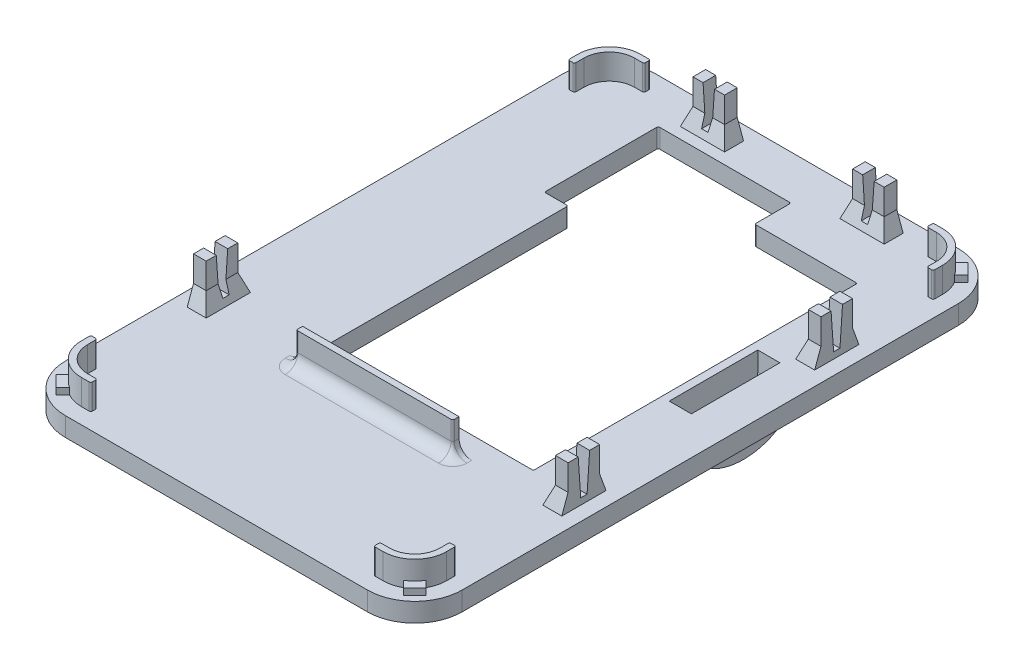
from build123d import *

# Parameters (mm, degrees)
BOSSAGE_BASE_DEPTH                 = 1.5
BOSSAGE_CORNER_DEPTH               = 4
CONGE_CORNER_R                     = 0.25
CONGE_CORNER_OF_SYM_TRIE1_CORNER_R = 0.25
SYM_TRIE2_CORNER_START             = 1
SYM_TRIE2_CORNER_DEPTH             = 4.5
ENL_V_OPENING_DEPTH                = 57.735818713
ENL_V_OPENING_DEPTH_BACK           = 57.735818713
ESQUISSE4_W                        = 3.5
ESQUISSE4_H                        = 14
BALAYAGE_BATTERIE_START            = 21.875
BALAYAGE_BATTERIE_DEPTH            = 3.5
BOSSAGE_BATTERIE_DEPTH             = 1.25
ESQUISSE8_W                        = 5
ESQUISSE8_H                        = 2
ESQUISSE8_W_2                      = 2
ESQUISSE8_H_2                      = 5
BOSSAGE_CLIP_DEPTH                 = 6.8
ENL_V_CLIP_RIGHT_REACH             = 78.907
ENL_V_CLIP_BACK_RIGHT_REACH        = 98.85
ENL_V_CLIP_BACK_LEFT_REACH         = 98.85
ENL_V_CLIP_LEFT1_REACH             = 99.397
ENL_V_CLIP_LEFT2_REACH             = 99.397
CHANFREIN_CLIP_SIZE                = 1
CHANFREIN_CLIP_SIZE_2              = 2.747477419
ESQUISSE15_W                       = 24.75
ESQUISSE15_H                       = 1
BOSSAGE_PALETTE_DEPTH              = 5
CONG_OPENING_R                     = 0.25
CONG_PALETTE_R                     = 2
BOSSAGE_SPACING_DEPTH              = 2.5


with BuildPart() as part:
    # Esquisse1 → Bossage_base (new, symmetric)
    with BuildSketch(Plane(origin=(0, 0, 0), x_dir=(1, 0, 0), z_dir=(0, 1, 0))):
        with BuildLine():
            Line((-23.875, -46.75), (23.875, -46.75))
            ThreePointArc((23.875, -46.75), (29.178300859, -44.553300859), (31.375, -39.25))
            Line((31.375, -39.25), (31.375, 39.25))
            ThreePointArc((31.375, 39.25), (29.178300859, 44.553300859), (23.875, 46.75))
            Line((23.875, 46.75), (-23.875, 46.75))
            ThreePointArc((-23.875, 46.75), (-29.178300859, 44.553300859), (-31.375, 39.25))
            Line((-31.375, 39.25), (-31.375, -39.25))
            ThreePointArc((-31.375, -39.25), (-29.178300859, -44.553300859), (-23.875, -46.75))
        make_face()
    extrude(amount=BOSSAGE_BASE_DEPTH, both=True)

    # Esquisse3 → Bossage_corner (add)
    with BuildSketch(Plane(origin=(0, 1.5, 0), x_dir=(1, 0, 0), z_dir=(0, 1, 0))):
        with BuildLine():
            Line((-23.875, 44.25), (-22.375, 44.25))
            Line((-22.375, 44.25), (-22.375, 43.25))
            Line((-22.375, 43.25), (-23.875, 43.25))
            ThreePointArc((-23.875, 43.25), (-26.703427125, 42.078427125), (-27.875, 39.25))
            Line((-27.875, 39.25), (-27.875, 37.75))
            Line((-27.875, 37.75), (-28.875, 37.75))
            Line((-28.875, 37.75), (-28.875, 39.25))
            ThreePointArc((-28.875, 39.25), (-27.410533906, 42.785533906), (-23.875, 44.25))
        make_face()
    bossage_corner = extrude(amount=BOSSAGE_CORNER_DEPTH)

    # Conge_corner
    conge_corner_edges = [part.edges().sort_by_distance(p)[0] for p in [
        (-22.375, 3.5, -43.25),
        (-22.375, 3.5, -44.25),
        (-28.875, 3.5, -37.75),
        (-27.875, 3.5, -37.75),
    ]]
    fillet(conge_corner_edges, radius=CONGE_CORNER_R)

    # Symétrie1_corner: Bossage_corner across plane
    add(bossage_corner.mirror(Plane(origin=(0, 0, 0), x_dir=(0, 0, 1), z_dir=(1, 0, 0))))

    # Conge_corner of Symétrie1_corner
    conge_corner_of_sym_trie1_corner_edges = [part.edges().sort_by_distance(p)[0] for p in [
        (22.375, 3.5, -43.25),
        (22.375, 3.5, -44.25),
        (28.875, 3.5, -37.75),
        (27.875, 3.5, -37.75),
    ]]
    fillet(conge_corner_of_sym_trie1_corner_edges, radius=CONGE_CORNER_OF_SYM_TRIE1_CORNER_R)

    # Symétrie2_corner: read off the stored shape, not the designer's step
    # Symétrie2_corner outline → Symétrie2_corner (add)
    with BuildSketch(Plane(origin=(0, 0, 0), x_dir=(1, 0, 0), z_dir=(0, 1, 0)).offset(SYM_TRIE2_CORNER_START)):
        with BuildLine():
            ThreePointArc((-22.625, -44.25), (-22.448223305, -44.176776695), (-22.375, -44))
            Line((-22.375, -44), (-22.375, -43.5))
            ThreePointArc((-22.375, -43.5), (-22.448223305, -43.323223305), (-22.625, -43.25))
            Line((-22.625, -43.25), (-23.875, -43.25))
            ThreePointArc((-23.875, -43.25), (-26.703427125, -42.078427125), (-27.875, -39.25))
            Line((-27.875, -39.25), (-27.875, -38))
            ThreePointArc((-27.875, -38), (-27.948223305, -37.823223305), (-28.125, -37.75))
            Line((-28.125, -37.75), (-28.625, -37.75))
            ThreePointArc((-28.625, -37.75), (-28.801776695, -37.823223305), (-28.875, -38))
            Line((-28.875, -38), (-28.875, -39.25))
            ThreePointArc((-28.875, -39.25), (-27.410533906, -42.785533906), (-23.875, -44.25))
            Line((-23.875, -44.25), (-22.625, -44.25))
        make_face()
        with BuildLine():
            Line((27.875, -38), (27.875, -39.25))
            ThreePointArc((27.875, -39.25), (26.703427125, -42.078427125), (23.875, -43.25))
            Line((23.875, -43.25), (22.625, -43.25))
            ThreePointArc((22.625, -43.25), (22.448223305, -43.323223305), (22.375, -43.5))
            Line((22.375, -43.5), (22.375, -44))
            ThreePointArc((22.375, -44), (22.448223305, -44.176776695), (22.625, -44.25))
            Line((22.625, -44.25), (23.875, -44.25))
            ThreePointArc((23.875, -44.25), (27.410533906, -42.785533906), (28.875, -39.25))
            Line((28.875, -39.25), (28.875, -38))
            ThreePointArc((28.875, -38), (28.801776695, -37.823223305), (28.625, -37.75))
            Line((28.625, -37.75), (28.125, -37.75))
            ThreePointArc((28.125, -37.75), (27.948223305, -37.823223305), (27.875, -38))
        make_face()
    extrude(amount=SYM_TRIE2_CORNER_DEPTH)

    # Esquisse4 → Enlèv_opening (cut, two sides: drawn at the far end of the back side and taken through both)
    with BuildSketch(Plane(origin=(0, -1.5, 0), x_dir=(-1, 0, 0), z_dir=(0, -1, 0)).offset(-ENL_V_OPENING_DEPTH_BACK)):
        Polygon((-20.625, 34), (-4.375, 34), (-4.375, 39.75), (16.625, 39.75), (16.625, 21.75), (12.875, 21.75), (12.875, -20.5), (-3.625, -20.5), (-3.625, -17.25), (-20.625, -17.25), align=None)
        with Locations((-23.625, 10)):
            Rectangle(ESQUISSE4_W, ESQUISSE4_H)
    extrude(amount=ENL_V_OPENING_DEPTH + ENL_V_OPENING_DEPTH_BACK, mode=Mode.SUBTRACT)

    # Balayage_batterie: read off the stored shape, not the designer's step
    # Balayage_batterie outline → Balayage_batterie (add)
    with BuildSketch(Plane.YZ.offset(BALAYAGE_BATTERIE_START)):
        with BuildLine():
            Line((-1.5, -3), (-1.5, -1.75))
            add(Edge.make_bspline(
                [(-1.5, -1.75), (-3.190722232, -1.750000002), (-4.786990528, -2.705218815), (-7.00497116, -5.780146506), (-7.625, -7.885757532), (-7.625, -12.114242468), (-7.00497116, -14.219853494), (-4.786990528, -17.294781185), (-3.190722232, -18.249999998), (-1.5, -18.25)],
                knots=[0, 0, 0, 0, 0.25, 0.25, 0.5, 0.5, 0.75, 0.75, 1, 1, 1, 1], degree=3))
            Line((-1.5, -18.25), (-1.5, -17))
            add(Edge.make_bspline(
                [(-1.5, -3), (-2.708159254, -3.000000002), (-3.954865391, -3.68832461), (-5.809522107, -6.259553243), (-6.375, -8.121805918), (-6.375, -11.878194082), (-5.809522107, -13.740446757), (-3.954865391, -16.31167539), (-2.708159254, -16.999999998), (-1.5, -17)],
                knots=[0, 0, 0, 0, 0.25, 0.25, 0.5, 0.5, 0.75, 0.75, 1, 1, 1, 1], degree=3))
        make_face()
    extrude(amount=BALAYAGE_BATTERIE_DEPTH)

    # Esquisse7 → Bossage_batterie (add)
    with BuildSketch(Plane(origin=(25.375, 0, 0), x_dir=(0, 0, -1), z_dir=(1, 0, 0))):
        with BuildLine():
            Line((1.75, -1.5), (18.25, -1.5))
            add(Edge.make_bspline(
                [(1.75, -1.5), (1.750000002, -3.190722232), (2.705218815, -4.786990528), (5.780146506, -7.00497116), (7.885757532, -7.625), (12.114242468, -7.625), (14.219853494, -7.00497116), (17.294781185, -4.786990528), (18.249999998, -3.190722232), (18.25, -1.5)],
                knots=[0, 0, 0, 0, 0.25, 0.25, 0.5, 0.5, 0.75, 0.75, 1, 1, 1, 1], degree=3))
        make_face()
    bossage_batterie = extrude(amount=BOSSAGE_BATTERIE_DEPTH)

    # Symétrie_batterie: Bossage_batterie across plane
    add(bossage_batterie.mirror(Plane.ZY.offset(-23.625)))

    # Esquisse8 → Bossage_clip (add)
    with BuildSketch(Plane(origin=(0, 1.5, 0), x_dir=(1, 0, 0), z_dir=(0, 1, 0))):
        with Locations((13.875, 43.5)):
            Rectangle(ESQUISSE8_W, ESQUISSE8_H)
        with Locations((-11.375, 43.5)):
            Rectangle(ESQUISSE8_W, ESQUISSE8_H)
        with Locations((-28.125, -18.75)):
            Rectangle(ESQUISSE8_W_2, ESQUISSE8_H_2)
        with Locations((28.125, 22.25)):
            Rectangle(ESQUISSE8_W_2, ESQUISSE8_H_2)
        with Locations((28.125, -17.75)):
            Rectangle(ESQUISSE8_W_2, ESQUISSE8_H_2)
    extrude(amount=BOSSAGE_CLIP_DEPTH)

    # Esquisse9 → Enlèv_clip_right (cut, up to next)
    with BuildSketch(Plane.ZY.offset(29.125), mode=Mode.PRIVATE) as enl_v_clip_right_sk1:
        Polygon((19.655575509, 8.3), (17.844424491, 8.3), (18.25, 2.5), (19.25, 2.5), align=None)
    enl_v_clip_right_tool1 = extrude(enl_v_clip_right_sk1.sketch, amount=-ENL_V_CLIP_RIGHT_REACH, mode=Mode.PRIVATE) & part.part
    add(enl_v_clip_right_tool1.solids().sort_by_distance((-29.125, 5.678929, 18.75))[0], mode=Mode.SUBTRACT)

    # Esquisse10 → Enlèv_clip_back_right (cut, up to next)
    with BuildSketch(Plane.XY.offset(-44.5), mode=Mode.PRIVATE) as enl_v_clip_back_right_sk1:
        Polygon((-10.469424491, 8.3), (-12.280575509, 8.3), (-11.875, 2.5), (-10.875, 2.5), align=None)
    enl_v_clip_back_right_tool1 = extrude(enl_v_clip_back_right_sk1.sketch, amount=ENL_V_CLIP_BACK_RIGHT_REACH, mode=Mode.PRIVATE) & part.part
    add(enl_v_clip_back_right_tool1.solids().sort_by_distance((-11.375, 5.678929, -44.5))[0], mode=Mode.SUBTRACT)

    # Esquisse11 → Enlèv_clip_back_left (cut, up to next)
    with BuildSketch(Plane.XY.offset(-44.5), mode=Mode.PRIVATE) as enl_v_clip_back_left_sk1:
        Polygon((14.780575509, 8.3), (12.969424491, 8.3), (13.375, 2.5), (14.375, 2.5), align=None)
    enl_v_clip_back_left_tool1 = extrude(enl_v_clip_back_left_sk1.sketch, amount=ENL_V_CLIP_BACK_LEFT_REACH, mode=Mode.PRIVATE) & part.part
    add(enl_v_clip_back_left_tool1.solids().sort_by_distance((13.875, 5.678929, -44.5))[0], mode=Mode.SUBTRACT)

    # Esquisse12 → Enlèv_clip_left1 (cut, up to next)
    with BuildSketch(Plane(origin=(29.125, 0, -29.125), x_dir=(0, 0, 1), z_dir=(-1, 0, 0)), mode=Mode.PRIVATE) as enl_v_clip_left1_sk1:
        Polygon((7.780575509, 8.3), (5.969424491, 8.3), (6.375, 2.5), (7.375, 2.5), align=None)
    enl_v_clip_left1_tool1 = extrude(enl_v_clip_left1_sk1.sketch, amount=ENL_V_CLIP_LEFT1_REACH, mode=Mode.PRIVATE) & part.part
    add(enl_v_clip_left1_tool1.solids().sort_by_distance((29.125, 5.678929, -22.25))[0], mode=Mode.SUBTRACT)

    # Esquisse13 → Enlèv_clip_left2 (cut, up to next)
    with BuildSketch(Plane(origin=(29.125, 0, -29.125), x_dir=(0, 0, 1), z_dir=(-1, 0, 0)), mode=Mode.PRIVATE) as enl_v_clip_left2_sk1:
        Polygon((47.780575509, 8.3), (45.969424491, 8.3), (46.375, 2.5), (47.375, 2.5), align=None)
    enl_v_clip_left2_tool1 = extrude(enl_v_clip_left2_sk1.sketch, amount=ENL_V_CLIP_LEFT2_REACH, mode=Mode.PRIVATE) & part.part
    add(enl_v_clip_left2_tool1.solids().sort_by_distance((29.125, 5.678929, 17.75))[0], mode=Mode.SUBTRACT)

    # Chanfrein_clip
    # the kernel refuses this chamfer: 2.747477419, 1 mm, written as the material it adds along each edge
    with BuildSketch(Plane(origin=(-19.997508551, 1.5, 21.25), x_dir=(0, 0, 1), z_dir=(-1, 0, 0))) as chanfrein_clip_piece_1_section:
        Polygon((CHANFREIN_CLIP_SIZE, 0), (0, CHANFREIN_CLIP_SIZE_2), (0, 0), align=None)
    chanfrein_clip_piece_1 = extrude(amount=9.127491449, mode=Mode.PRIVATE)
    chanfrein_clip_piece_1 = split(chanfrein_clip_piece_1, bisect_by=Plane(origin=(-25.408219663, -0.469337791, 21.25), z_dir=(-0.9396926207859094, -0.34202014332566605, 0)), keep=Keep.TOP, mode=Mode.PRIVATE)
    add(chanfrein_clip_piece_1)
    with BuildSketch(Plane(origin=(-27.125, 1.5, 9.122508551), x_dir=(1, 0, 0), z_dir=(0, 0, 1))) as chanfrein_clip_piece_2_section:
        Polygon((CHANFREIN_CLIP_SIZE, 0), (0, CHANFREIN_CLIP_SIZE_2), (0, 0), align=None)
    chanfrein_clip_piece_2 = extrude(amount=19.254982899, mode=Mode.PRIVATE)
    chanfrein_clip_piece_2 = split(chanfrein_clip_piece_2, bisect_by=Plane(origin=(-27.125, 2.5, 9.122508551), z_dir=(0, -1, 0)), keep=Keep.TOP, mode=Mode.PRIVATE)
    chanfrein_clip_piece_2 = split(chanfrein_clip_piece_2, bisect_by=Plane(origin=(-27.125, 5.719094425, 20.714375214), z_dir=(0, -0.34202014332566605, -0.9396926207859094)), keep=Keep.TOP, mode=Mode.PRIVATE)
    chanfrein_clip_piece_2 = split(chanfrein_clip_piece_2, bisect_by=Plane(origin=(-27.125, -0.469337791, 14.533219663), z_dir=(0, -0.34202014332566605, 0.9396926207859094)), keep=Keep.TOP, mode=Mode.PRIVATE)
    add(chanfrein_clip_piece_2)
    with BuildSketch(Plane(origin=(-27.125, 1.5, 9.122508551), x_dir=(1, 0, 0), z_dir=(0, 0, 1))) as chanfrein_clip_piece_3_section:
        Polygon((CHANFREIN_CLIP_SIZE, 0), (0, CHANFREIN_CLIP_SIZE_2), (0, 0), align=None)
    chanfrein_clip_piece_3 = extrude(amount=19.254982899, mode=Mode.PRIVATE)
    chanfrein_clip_piece_3 = split(chanfrein_clip_piece_3, bisect_by=Plane(origin=(-27.125, 2.14001661, 18.275172491), z_dir=(0, -0.06975647374412401, -0.9975640502598243)), keep=Keep.TOP, mode=Mode.PRIVATE)
    chanfrein_clip_piece_3 = split(chanfrein_clip_piece_3, bisect_by=Plane(origin=(-27.125, -0.469337791, 14.533219663), z_dir=(0, -0.34202014332566605, 0.9396926207859094)), keep=Keep.TOP, mode=Mode.PRIVATE)
    add(chanfrein_clip_piece_3)
    with BuildSketch(Plane(origin=(-27.125, 1.5, 9.122508551), x_dir=(1, 0, 0), z_dir=(0, 0, 1))) as chanfrein_clip_piece_4_section:
        Polygon((CHANFREIN_CLIP_SIZE, 0), (0, CHANFREIN_CLIP_SIZE_2), (0, 0), align=None)
    chanfrein_clip_piece_4 = extrude(amount=19.254982899, mode=Mode.PRIVATE)
    chanfrein_clip_piece_4 = split(chanfrein_clip_piece_4, bisect_by=Plane(origin=(-27.125, 0.800128771, 19.131133424), z_dir=(0, -0.0697564737441234, 0.9975640502598244)), keep=Keep.TOP, mode=Mode.PRIVATE)
    chanfrein_clip_piece_4 = split(chanfrein_clip_piece_4, bisect_by=Plane(origin=(-27.125, 5.719094425, 20.714375214), z_dir=(0, -0.34202014332566605, -0.9396926207859094)), keep=Keep.TOP, mode=Mode.PRIVATE)
    add(chanfrein_clip_piece_4)
    with BuildSketch(Plane(origin=(-29.125, 1.5, 16.25), x_dir=(0, 0, -1), z_dir=(1, 0, 0))) as chanfrein_clip_piece_5_section:
        Polygon((CHANFREIN_CLIP_SIZE, 0), (0, CHANFREIN_CLIP_SIZE_2), (0, 0), align=None)
    chanfrein_clip_piece_5 = extrude(amount=9.127491449, mode=Mode.PRIVATE)
    chanfrein_clip_piece_5 = split(chanfrein_clip_piece_5, bisect_by=Plane(origin=(-26.475933335, 2.464181415, 16.25), z_dir=(-0.9396926207859094, -0.34202014332566605, 0)), keep=Keep.TOP, mode=Mode.PRIVATE)
    add(chanfrein_clip_piece_5)
    with BuildSketch(Plane(origin=(-13.875, 1.5, -35.372508551), x_dir=(-1, 0, 0), z_dir=(0, 0, -1))) as chanfrein_clip_piece_6_section:
        Polygon((CHANFREIN_CLIP_SIZE, 0), (0, CHANFREIN_CLIP_SIZE_2), (0, 0), align=None)
    chanfrein_clip_piece_6 = extrude(amount=9.127491449, mode=Mode.PRIVATE)
    chanfrein_clip_piece_6 = split(chanfrein_clip_piece_6, bisect_by=Plane(origin=(-13.875, -0.469337791, -40.783219663), z_dir=(0, -0.34202014332566605, -0.9396926207859094)), keep=Keep.TOP, mode=Mode.PRIVATE)
    add(chanfrein_clip_piece_6)
    with BuildSketch(Plane(origin=(-1.747508551, 1.5, -42.5), x_dir=(0, 0, 1), z_dir=(-1, 0, 0))) as chanfrein_clip_piece_7_section:
        Polygon((CHANFREIN_CLIP_SIZE, 0), (0, CHANFREIN_CLIP_SIZE_2), (0, 0), align=None)
    chanfrein_clip_piece_7 = extrude(amount=19.254982899, mode=Mode.PRIVATE)
    chanfrein_clip_piece_7 = split(chanfrein_clip_piece_7, bisect_by=Plane(origin=(-1.747508551, 2.5, -42.5), z_dir=(0, -1, 0)), keep=Keep.TOP, mode=Mode.PRIVATE)
    chanfrein_clip_piece_7 = split(chanfrein_clip_piece_7, bisect_by=Plane(origin=(-13.339375214, 5.719094425, -42.5), z_dir=(0.9396926207859094, -0.34202014332566605, 1.6692294138669905e-15)), keep=Keep.TOP, mode=Mode.PRIVATE)
    chanfrein_clip_piece_7 = split(chanfrein_clip_piece_7, bisect_by=Plane(origin=(-7.158219663, -0.469337791, -42.5), z_dir=(-0.9396926207859094, -0.34202014332566605, 1.6692294138669905e-15)), keep=Keep.TOP, mode=Mode.PRIVATE)
    add(chanfrein_clip_piece_7)
    with BuildSketch(Plane(origin=(-1.747508551, 1.5, -42.5), x_dir=(0, 0, 1), z_dir=(-1, 0, 0))) as chanfrein_clip_piece_8_section:
        Polygon((CHANFREIN_CLIP_SIZE, 0), (0, CHANFREIN_CLIP_SIZE_2), (0, 0), align=None)
    chanfrein_clip_piece_8 = extrude(amount=19.254982899, mode=Mode.PRIVATE)
    chanfrein_clip_piece_8 = split(chanfrein_clip_piece_8, bisect_by=Plane(origin=(-10.900172491, 2.14001661, -42.5), z_dir=(0.9975640502598243, -0.06975647374412587, 0)), keep=Keep.TOP, mode=Mode.PRIVATE)
    chanfrein_clip_piece_8 = split(chanfrein_clip_piece_8, bisect_by=Plane(origin=(-7.158219663, -0.469337791, -42.5), z_dir=(-0.9396926207859094, -0.34202014332566605, 1.6692294138669905e-15)), keep=Keep.TOP, mode=Mode.PRIVATE)
    add(chanfrein_clip_piece_8)
    with BuildSketch(Plane(origin=(-1.747508551, 1.5, -42.5), x_dir=(0, 0, 1), z_dir=(-1, 0, 0))) as chanfrein_clip_piece_9_section:
        Polygon((CHANFREIN_CLIP_SIZE, 0), (0, CHANFREIN_CLIP_SIZE_2), (0, 0), align=None)
    chanfrein_clip_piece_9 = extrude(amount=19.254982899, mode=Mode.PRIVATE)
    chanfrein_clip_piece_9 = split(chanfrein_clip_piece_9, bisect_by=Plane(origin=(-11.756133424, 0.800128771, -42.5), z_dir=(-0.9975640502598243, -0.06975647374412587, 0)), keep=Keep.TOP, mode=Mode.PRIVATE)
    chanfrein_clip_piece_9 = split(chanfrein_clip_piece_9, bisect_by=Plane(origin=(-13.339375214, 5.719094425, -42.5), z_dir=(0.9396926207859094, -0.34202014332566605, 1.6692294138669905e-15)), keep=Keep.TOP, mode=Mode.PRIVATE)
    add(chanfrein_clip_piece_9)
    with BuildSketch(Plane(origin=(-8.875, 1.5, -44.5), x_dir=(1, 0, 0), z_dir=(0, 0, 1))) as chanfrein_clip_piece_10_section:
        Polygon((CHANFREIN_CLIP_SIZE, 0), (0, CHANFREIN_CLIP_SIZE_2), (0, 0), align=None)
    chanfrein_clip_piece_10 = extrude(amount=9.127491449, mode=Mode.PRIVATE)
    chanfrein_clip_piece_10 = split(chanfrein_clip_piece_10, bisect_by=Plane(origin=(-8.875, 2.464181415, -41.850933335), z_dir=(0, -0.34202014332566605, -0.9396926207859094)), keep=Keep.TOP, mode=Mode.PRIVATE)
    add(chanfrein_clip_piece_10)
    with BuildSketch(Plane(origin=(11.375, 1.5, -35.372508551), x_dir=(-1, 0, 0), z_dir=(0, 0, -1))) as chanfrein_clip_piece_11_section:
        Polygon((CHANFREIN_CLIP_SIZE, 0), (0, CHANFREIN_CLIP_SIZE_2), (0, 0), align=None)
    chanfrein_clip_piece_11 = extrude(amount=9.127491449, mode=Mode.PRIVATE)
    chanfrein_clip_piece_11 = split(chanfrein_clip_piece_11, bisect_by=Plane(origin=(11.375, -0.469337791, -40.783219663), z_dir=(0, -0.34202014332566605, -0.9396926207859094)), keep=Keep.TOP, mode=Mode.PRIVATE)
    add(chanfrein_clip_piece_11)
    with BuildSketch(Plane(origin=(23.502491449, 1.5, -42.5), x_dir=(0, 0, 1), z_dir=(-1, 0, 0))) as chanfrein_clip_piece_12_section:
        Polygon((CHANFREIN_CLIP_SIZE, 0), (0, CHANFREIN_CLIP_SIZE_2), (0, 0), align=None)
    chanfrein_clip_piece_12 = extrude(amount=19.254982899, mode=Mode.PRIVATE)
    chanfrein_clip_piece_12 = split(chanfrein_clip_piece_12, bisect_by=Plane(origin=(23.502491449, 2.5, -42.5), z_dir=(0, -1, 0)), keep=Keep.TOP, mode=Mode.PRIVATE)
    chanfrein_clip_piece_12 = split(chanfrein_clip_piece_12, bisect_by=Plane(origin=(11.910624786, 5.719094425, -42.5), z_dir=(0.9396926207859094, -0.34202014332566605, 0)), keep=Keep.TOP, mode=Mode.PRIVATE)
    chanfrein_clip_piece_12 = split(chanfrein_clip_piece_12, bisect_by=Plane(origin=(18.091780337, -0.469337791, -42.5), z_dir=(-0.939692620785909, -0.3420201433256671, -1.6692294138669895e-15)), keep=Keep.TOP, mode=Mode.PRIVATE)
    add(chanfrein_clip_piece_12)
    with BuildSketch(Plane(origin=(23.502491449, 1.5, -42.5), x_dir=(0, 0, 1), z_dir=(-1, 0, 0))) as chanfrein_clip_piece_13_section:
        Polygon((CHANFREIN_CLIP_SIZE, 0), (0, CHANFREIN_CLIP_SIZE_2), (0, 0), align=None)
    chanfrein_clip_piece_13 = extrude(amount=19.254982899, mode=Mode.PRIVATE)
    chanfrein_clip_piece_13 = split(chanfrein_clip_piece_13, bisect_by=Plane(origin=(14.349827509, 2.14001661, -42.5), z_dir=(0.9975640502598243, -0.06975647374412525, 0)), keep=Keep.TOP, mode=Mode.PRIVATE)
    chanfrein_clip_piece_13 = split(chanfrein_clip_piece_13, bisect_by=Plane(origin=(18.091780337, -0.469337791, -42.5), z_dir=(-0.939692620785909, -0.3420201433256671, -1.6692294138669895e-15)), keep=Keep.TOP, mode=Mode.PRIVATE)
    add(chanfrein_clip_piece_13)
    with BuildSketch(Plane(origin=(23.502491449, 1.5, -42.5), x_dir=(0, 0, 1), z_dir=(-1, 0, 0))) as chanfrein_clip_piece_14_section:
        Polygon((CHANFREIN_CLIP_SIZE, 0), (0, CHANFREIN_CLIP_SIZE_2), (0, 0), align=None)
    chanfrein_clip_piece_14 = extrude(amount=19.254982899, mode=Mode.PRIVATE)
    chanfrein_clip_piece_14 = split(chanfrein_clip_piece_14, bisect_by=Plane(origin=(13.493866576, 0.800128771, -42.5), z_dir=(-0.9975640502598243, -0.06975647374412555, 0)), keep=Keep.TOP, mode=Mode.PRIVATE)
    chanfrein_clip_piece_14 = split(chanfrein_clip_piece_14, bisect_by=Plane(origin=(11.910624786, 5.719094425, -42.5), z_dir=(0.9396926207859094, -0.34202014332566605, 0)), keep=Keep.TOP, mode=Mode.PRIVATE)
    add(chanfrein_clip_piece_14)
    with BuildSketch(Plane(origin=(16.375, 1.5, -44.5), x_dir=(1, 0, 0), z_dir=(0, 0, 1))) as chanfrein_clip_piece_15_section:
        Polygon((CHANFREIN_CLIP_SIZE, 0), (0, CHANFREIN_CLIP_SIZE_2), (0, 0), align=None)
    chanfrein_clip_piece_15 = extrude(amount=9.127491449, mode=Mode.PRIVATE)
    chanfrein_clip_piece_15 = split(chanfrein_clip_piece_15, bisect_by=Plane(origin=(16.375, 2.464181415, -41.850933335), z_dir=(0, -0.34202014332566605, -0.9396926207859094)), keep=Keep.TOP, mode=Mode.PRIVATE)
    add(chanfrein_clip_piece_15)
    with BuildSketch(Plane(origin=(29.125, 1.5, -24.75), x_dir=(0, 0, -1), z_dir=(-1, 0, 0))) as chanfrein_clip_piece_16_section:
        Polygon((CHANFREIN_CLIP_SIZE, 0), (0, -CHANFREIN_CLIP_SIZE_2), (0, 0), align=None)
    chanfrein_clip_piece_16 = extrude(amount=9.127491449, mode=Mode.PRIVATE)
    chanfrein_clip_piece_16 = split(chanfrein_clip_piece_16, bisect_by=Plane(origin=(26.475933335, 2.464181415, -24.75), z_dir=(0.9396926207859094, -0.34202014332566605, 0)), keep=Keep.TOP, mode=Mode.PRIVATE)
    add(chanfrein_clip_piece_16)
    with BuildSketch(Plane(origin=(27.125, 1.5, -31.877491449), x_dir=(-1, 0, 0), z_dir=(0, 0, 1))) as chanfrein_clip_piece_17_section:
        Polygon((CHANFREIN_CLIP_SIZE, 0), (0, -CHANFREIN_CLIP_SIZE_2), (0, 0), align=None)
    chanfrein_clip_piece_17 = extrude(amount=19.254982899, mode=Mode.PRIVATE)
    chanfrein_clip_piece_17 = split(chanfrein_clip_piece_17, bisect_by=Plane(origin=(27.125, 2.5, -31.877491449), z_dir=(0, -1, 0)), keep=Keep.TOP, mode=Mode.PRIVATE)
    chanfrein_clip_piece_17 = split(chanfrein_clip_piece_17, bisect_by=Plane(origin=(27.125, 5.719094425, -20.285624786), z_dir=(-1.6692294138669964e-15, -0.34202014332566605, -0.9396926207859094)), keep=Keep.TOP, mode=Mode.PRIVATE)
    chanfrein_clip_piece_17 = split(chanfrein_clip_piece_17, bisect_by=Plane(origin=(27.125, -0.469337791, -26.466780337), z_dir=(-1.6692294138669964e-15, -0.34202014332566605, 0.9396926207859094)), keep=Keep.TOP, mode=Mode.PRIVATE)
    add(chanfrein_clip_piece_17)
    with BuildSketch(Plane(origin=(27.125, 1.5, -31.877491449), x_dir=(-1, 0, 0), z_dir=(0, 0, 1))) as chanfrein_clip_piece_18_section:
        Polygon((CHANFREIN_CLIP_SIZE, 0), (0, -CHANFREIN_CLIP_SIZE_2), (0, 0), align=None)
    chanfrein_clip_piece_18 = extrude(amount=19.254982899, mode=Mode.PRIVATE)
    chanfrein_clip_piece_18 = split(chanfrein_clip_piece_18, bisect_by=Plane(origin=(27.125, 2.14001661, -22.724827509), z_dir=(0, -0.06975647374412568, -0.9975640502598243)), keep=Keep.TOP, mode=Mode.PRIVATE)
    chanfrein_clip_piece_18 = split(chanfrein_clip_piece_18, bisect_by=Plane(origin=(27.125, -0.469337791, -26.466780337), z_dir=(-1.6692294138669964e-15, -0.34202014332566605, 0.9396926207859094)), keep=Keep.TOP, mode=Mode.PRIVATE)
    add(chanfrein_clip_piece_18)
    with BuildSketch(Plane(origin=(27.125, 1.5, -31.877491449), x_dir=(-1, 0, 0), z_dir=(0, 0, 1))) as chanfrein_clip_piece_19_section:
        Polygon((CHANFREIN_CLIP_SIZE, 0), (0, -CHANFREIN_CLIP_SIZE_2), (0, 0), align=None)
    chanfrein_clip_piece_19 = extrude(amount=19.254982899, mode=Mode.PRIVATE)
    chanfrein_clip_piece_19 = split(chanfrein_clip_piece_19, bisect_by=Plane(origin=(27.125, 0.800128771, -21.868866576), z_dir=(0, -0.06975647374412583, 0.9975640502598243)), keep=Keep.TOP, mode=Mode.PRIVATE)
    chanfrein_clip_piece_19 = split(chanfrein_clip_piece_19, bisect_by=Plane(origin=(27.125, 5.719094425, -20.285624786), z_dir=(-1.6692294138669964e-15, -0.34202014332566605, -0.9396926207859094)), keep=Keep.TOP, mode=Mode.PRIVATE)
    add(chanfrein_clip_piece_19)
    with BuildSketch(Plane(origin=(19.997508551, 1.5, -19.75), x_dir=(0, 0, 1), z_dir=(1, 0, 0))) as chanfrein_clip_piece_20_section:
        Polygon((CHANFREIN_CLIP_SIZE, 0), (0, -CHANFREIN_CLIP_SIZE_2), (0, 0), align=None)
    chanfrein_clip_piece_20 = extrude(amount=9.127491449, mode=Mode.PRIVATE)
    chanfrein_clip_piece_20 = split(chanfrein_clip_piece_20, bisect_by=Plane(origin=(25.408219663, -0.469337791, -19.75), z_dir=(0.9396926207859094, -0.34202014332566605, 0)), keep=Keep.TOP, mode=Mode.PRIVATE)
    add(chanfrein_clip_piece_20)
    with BuildSketch(Plane(origin=(29.125, 1.5, 15.25), x_dir=(0, 0, -1), z_dir=(-1, 0, 0))) as chanfrein_clip_piece_21_section:
        Polygon((CHANFREIN_CLIP_SIZE, 0), (0, -CHANFREIN_CLIP_SIZE_2), (0, 0), align=None)
    chanfrein_clip_piece_21 = extrude(amount=9.127491449, mode=Mode.PRIVATE)
    chanfrein_clip_piece_21 = split(chanfrein_clip_piece_21, bisect_by=Plane(origin=(26.475933335, 2.464181415, 15.25), z_dir=(0.9396926207859094, -0.34202014332566605, 0)), keep=Keep.TOP, mode=Mode.PRIVATE)
    add(chanfrein_clip_piece_21)
    with BuildSketch(Plane(origin=(27.125, 1.5, 8.122508551), x_dir=(-1, 0, 0), z_dir=(0, 0, 1))) as chanfrein_clip_piece_22_section:
        Polygon((CHANFREIN_CLIP_SIZE, 0), (0, -CHANFREIN_CLIP_SIZE_2), (0, 0), align=None)
    chanfrein_clip_piece_22 = extrude(amount=19.254982899, mode=Mode.PRIVATE)
    chanfrein_clip_piece_22 = split(chanfrein_clip_piece_22, bisect_by=Plane(origin=(27.125, 2.5, 8.122508551), z_dir=(0, -1, 0)), keep=Keep.TOP, mode=Mode.PRIVATE)
    chanfrein_clip_piece_22 = split(chanfrein_clip_piece_22, bisect_by=Plane(origin=(27.125, -0.469337791, 13.533219663), z_dir=(0, -0.34202014332566605, 0.9396926207859094)), keep=Keep.TOP, mode=Mode.PRIVATE)
    chanfrein_clip_piece_22 = split(chanfrein_clip_piece_22, bisect_by=Plane(origin=(27.125, 5.719094425, 19.714375214), z_dir=(0, -0.34202014332566605, -0.9396926207859094)), keep=Keep.TOP, mode=Mode.PRIVATE)
    add(chanfrein_clip_piece_22)
    with BuildSketch(Plane(origin=(27.125, 1.5, 8.122508551), x_dir=(-1, 0, 0), z_dir=(0, 0, 1))) as chanfrein_clip_piece_23_section:
        Polygon((CHANFREIN_CLIP_SIZE, 0), (0, -CHANFREIN_CLIP_SIZE_2), (0, 0), align=None)
    chanfrein_clip_piece_23 = extrude(amount=19.254982899, mode=Mode.PRIVATE)
    chanfrein_clip_piece_23 = split(chanfrein_clip_piece_23, bisect_by=Plane(origin=(27.125, 2.14001661, 17.275172491), z_dir=(0, -0.06975647374412647, -0.9975640502598242)), keep=Keep.TOP, mode=Mode.PRIVATE)
    chanfrein_clip_piece_23 = split(chanfrein_clip_piece_23, bisect_by=Plane(origin=(27.125, -0.469337791, 13.533219663), z_dir=(0, -0.34202014332566605, 0.9396926207859094)), keep=Keep.TOP, mode=Mode.PRIVATE)
    add(chanfrein_clip_piece_23)
    with BuildSketch(Plane(origin=(27.125, 1.5, 8.122508551), x_dir=(-1, 0, 0), z_dir=(0, 0, 1))) as chanfrein_clip_piece_24_section:
        Polygon((CHANFREIN_CLIP_SIZE, 0), (0, -CHANFREIN_CLIP_SIZE_2), (0, 0), align=None)
    chanfrein_clip_piece_24 = extrude(amount=19.254982899, mode=Mode.PRIVATE)
    chanfrein_clip_piece_24 = split(chanfrein_clip_piece_24, bisect_by=Plane(origin=(27.125, 0.800128771, 18.131133424), z_dir=(0, -0.0697564737441265, 0.9975640502598242)), keep=Keep.TOP, mode=Mode.PRIVATE)
    chanfrein_clip_piece_24 = split(chanfrein_clip_piece_24, bisect_by=Plane(origin=(27.125, 5.719094425, 19.714375214), z_dir=(0, -0.34202014332566605, -0.9396926207859094)), keep=Keep.TOP, mode=Mode.PRIVATE)
    add(chanfrein_clip_piece_24)
    with BuildSketch(Plane(origin=(19.997508551, 1.5, 20.25), x_dir=(0, 0, 1), z_dir=(1, 0, 0))) as chanfrein_clip_piece_25_section:
        Polygon((CHANFREIN_CLIP_SIZE, 0), (0, -CHANFREIN_CLIP_SIZE_2), (0, 0), align=None)
    chanfrein_clip_piece_25 = extrude(amount=9.127491449, mode=Mode.PRIVATE)
    chanfrein_clip_piece_25 = split(chanfrein_clip_piece_25, bisect_by=Plane(origin=(25.408219663, -0.469337791, 20.25), z_dir=(0.9396926207859094, -0.34202014332566605, 0)), keep=Keep.TOP, mode=Mode.PRIVATE)
    add(chanfrein_clip_piece_25)

    # Esquisse15 → Bossage_palette (add)
    with BuildSketch(Plane(origin=(0, 1.5, 0), x_dir=(1, 0, 0), z_dir=(0, 1, 0))):
        with Locations((0, -21.25)):
            Rectangle(ESQUISSE15_W, ESQUISSE15_H)
    extrude(amount=BOSSAGE_PALETTE_DEPTH)

    # Congé_opening
    cong_opening_edges = [part.edges().sort_by_distance(p)[0] for p in [
        (20.625, 0, 17.25),
        (20.625, 0, -34),
        (4.375, 0, -34),
        (4.375, 0, -39.75),
        (-16.625, 0, -39.75),
        (-16.625, 0, -21.75),
        (-12.875, 0, -21.75),
        (-12.875, 0, 20.5),
        (3.625, 0, 20.5),
        (3.625, 0, 17.25),
        (-12.375, 4, 21.75),
        (12.375, 4, 21.75),
    ]]
    fillet(cong_opening_edges, radius=CONG_OPENING_R)

    # Congé_palette
    cong_palette_edges = [part.edges().sort_by_distance(p)[0] for p in [
        (-12.375, 1.5, 21.125),
        (12.375, 1.5, 21.125),
        (0, 1.5, 21.75),
        (12.301776695, 1.5, 21.676776695),
        (-12.301776695, 1.5, 21.676776695),
    ]]
    fillet(cong_palette_edges, radius=CONG_PALETTE_R)

    # Esquisse16 → Bossage_spacing (add)
    with BuildSketch(Plane(origin=(0, 0, 0), x_dir=(1, 0, 0), z_dir=(0, 1, 0))):
        Polygon((-28.182149461, 41.789382508), (-26.414382508, 43.557149461), (-27.47504268, 44.617809633), (-29.242809633, 42.85004268), align=None)
        Polygon((28.182149461, 41.789382508), (26.414382508, 43.557149461), (27.47504268, 44.617809633), (29.242809633, 42.85004268), align=None)
        Polygon((29.242809633, -42.85004268), (28.182149461, -41.789382508), (26.414382508, -43.557149461), (27.47504268, -44.617809633), align=None)
        Polygon((-28.182149461, -41.789382508), (-26.414382508, -43.557149461), (-27.47504268, -44.617809633), (-29.242809633, -42.85004268), align=None)
    extrude(amount=BOSSAGE_SPACING_DEPTH)


solid = part.part
